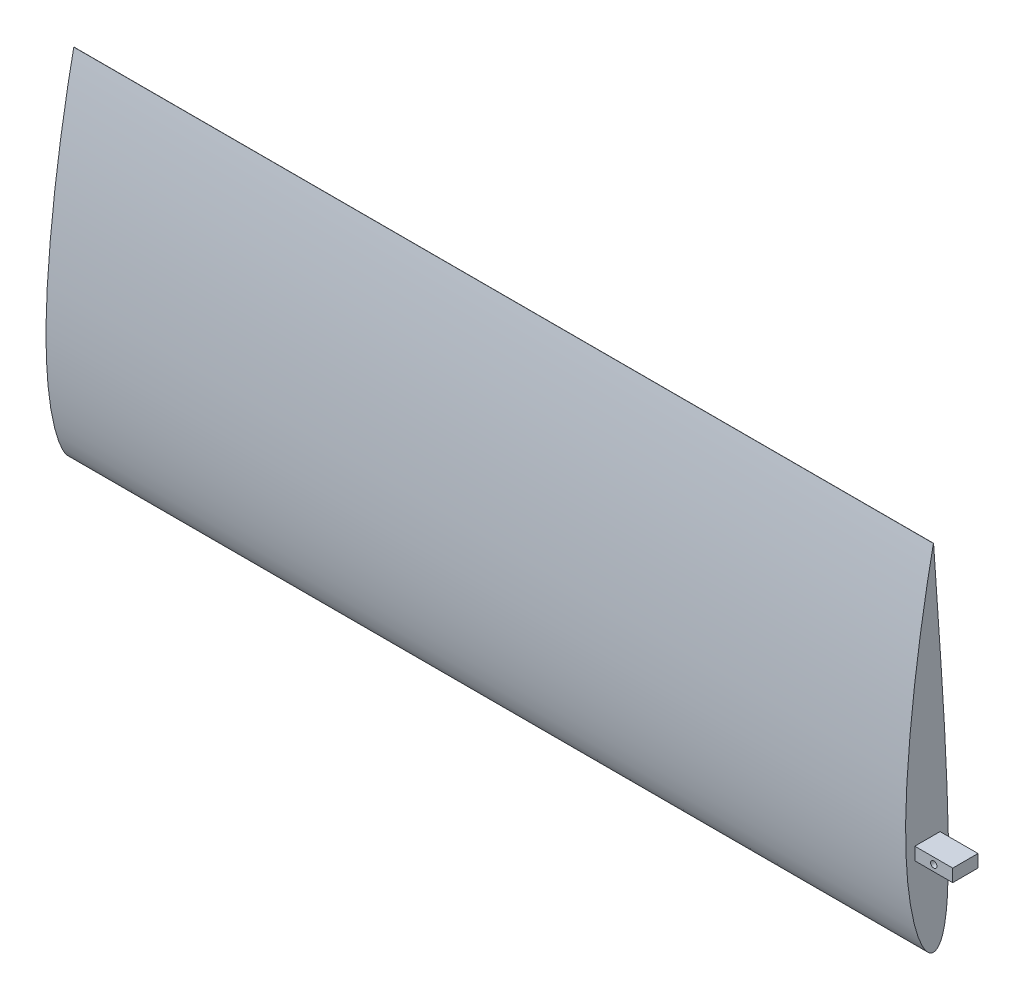
from build123d import *

# Parameters (mm, degrees)
BOSS_EXTRUDE1_DEPTH     = 914.4
CUT_EXTRUDE1_DEPTH      = 982.547981928
CUT_EXTRUDE1_DEPTH_BACK = 982.547981928
SKETCH2_W               = 101.6
SKETCH2_H               = 355.7016
CUT_EXTRUDE3_DEPTH      = 862.965
BOSS_EXTRUDE2_DEPTH     = 862.965
SKETCH7_W               = 25.4
SKETCH7_H               = 12.7
BOSS_EXTRUDE3_DEPTH     = 38.1
SKETCH8_R               = 3.175
CUT_EXTRUDE4_DEPTH      = 982.730874327


with BuildPart() as part:
    # Sketch1 → Boss-Extrude1 (new body)
    with BuildSketch(Plane(origin=(0, 0, 0), x_dir=(0, 0, -1), z_dir=(1, 0, 0))):
        with BuildLine():
            Line((0.107161403, 355.7016), (-0.070689384, 355.7016))
            add(Edge.make_bspline(
                [(-0.070689384, 355.7016), (-0.466477301, 353.821005474), (-1.257390268, 350.062966049), (-2.391261843, 344.419849121), (-3.495815308, 338.780602167), (-4.571931897, 333.145611843), (-5.624146346, 327.516510889), (-6.654132743, 321.894595016), (-7.997398438, 314.419324109), (-9.945522406, 303.25746297), (-12.095688112, 290.277775074), (-14.108266379, 277.369668), (-15.729652448, 266.404083363), (-17.745206313, 251.980108498), (-19.571200264, 237.689627436), (-21.215305741, 223.549431816), (-22.347366905, 213.141900318), (-23.38648148, 202.878012782), (-24.331674295, 192.768060411), (-25.180326784, 182.822187649), (-25.928484577, 173.050367055), (-26.674562593, 161.923020833), (-27.345486328, 149.535714938), (-27.840551721, 135.990974586), (-28.060725611, 122.943312688), (-28.002046095, 110.422427171), (-27.702820577, 99.702001348), (-27.264430386, 90.695171909), (-26.778207129, 83.305058943), (-26.183602895, 76.189184622), (-25.486294476, 69.354718788), (-24.692398131, 62.80853729), (-23.808328586, 56.557201024), (-22.840687769, 50.606973205), (-21.796246166, 44.963830369), (-20.681960011, 39.633415294), (-19.686877519, 35.395642593), (-18.668840846, 31.420703372), (-17.830503911, 28.402995737), (-16.953038009, 25.502253789), (-16.295688834, 23.446152208), (-15.629016033, 21.473655539), (-14.953909817, 19.585256686), (-14.271253624, 17.781420944), (-13.581895135, 16.062595446), (-12.886661884, 14.429199329), (-12.186346807, 12.881628381), (-11.481686051, 11.420261165), (-10.773396292, 10.04543679), (-10.062097884, 8.757490369), (-9.34839284, 7.556709508), (-8.632792002, 6.443369974), (-7.91573903, 5.417716148), (-7.197605959, 4.479967069), (-6.47867767, 3.630320834), (-5.759155979, 2.868957272), (-5.039142048, 2.19605649), (-4.318657554, 1.611798732), (-3.597634906, 1.11641082), (-2.875952573, 0.710164516), (-2.153489626, 0.393485727), (-1.430202503, 0.166619572), (-0.706187065, 0.03077979), (-0.000985808, -0.015114251), (0.684756584, 0.030079625), (1.348697256, 0.166740712), (2.007659563, 0.393317067), (2.659441583, 0.710058446), (3.302103095, 1.116343264), (3.933909812, 1.611857107), (4.553290425, 2.196297771), (5.158827727, 2.869428129), (5.749231153, 3.631048574), (6.323352434, 4.480969847), (6.880184982, 5.418999484), (7.418887755, 6.444929009), (7.938780897, 7.558528262), (8.439333201, 8.759551829), (8.920187899, 10.047719086), (9.38111076, 11.42273555), (9.822040709, 12.884270251), (10.243003979, 14.431978532), (10.644156378, 16.065484925), (11.025729315, 17.78439363), (11.388030769, 19.588284464), (11.731405451, 21.47671562), (12.056228849, 23.449222111), (12.362904642, 25.505314006), (12.65181215, 27.644482252), (12.923317343, 29.866195243), (13.177757541, 32.169900276), (13.499852463, 35.402342989), (13.858312346, 39.644181211), (14.217474108, 44.973851327), (14.512794252, 50.616200438), (14.744290134, 56.565612117), (14.91180091, 62.816123126), (15.015348807, 69.361468336), (15.055556296, 76.19507344), (15.033927365, 83.310049608), (14.95305361, 90.699222818), (14.816566284, 98.355150745), (14.628926379, 106.27014854), (14.395047132, 114.436264929), (14.119797884, 122.845292004), (13.80742065, 131.488784123), (13.461091997, 140.358056449), (13.082513447, 149.444192088), (12.529118258, 161.966906534), (11.914202813, 174.747012914), (11.23057546, 187.771233814), (10.673385511, 197.800288277), (10.076443223, 207.988276057), (9.333666459, 220.087933402), (8.545388829, 232.345213804), (7.727884289, 244.74825108), (7.012410075, 255.522479057), (6.413248687, 264.566087926), (5.812205548, 273.686981089), (5.209897824, 282.876004642), (4.484082626, 293.955761906), (3.867734567, 303.229482659), (3.360161258, 310.676514812), (2.970245095, 316.279904259), (2.570443063, 321.893186998), (2.160539213, 327.514926735), (1.741925541, 333.143678), (1.317712761, 338.777987211), (0.895533142, 344.416460162), (0.48132907, 350.057405862), (0.231880233, 353.820258158), (0.107161403, 355.7016)],
                knots=[0, 0, 0, 0, 0.007940543, 0.015867786, 0.023782336, 0.031683842, 0.039571466, 0.047443805, 0.055299407, 0.070952907, 0.094259966, 0.109659749, 0.124931368, 0.140060475, 0.169836167, 0.184455938, 0.198878988, 0.213091981, 0.227081364, 0.240833733, 0.254335896, 0.267574898, 0.286913018, 0.305591757, 0.323574751, 0.340828862, 0.357323531, 0.367884026, 0.378086462, 0.387923234, 0.397387015, 0.406470797, 0.41516795, 0.423472244, 0.43137777, 0.438879022, 0.445971139, 0.449362331, 0.455832514, 0.458910652, 0.461883669, 0.464751272, 0.467513247, 0.470169459, 0.472719872, 0.475164567, 0.477503762, 0.479737826, 0.481867333, 0.483893084, 0.485816152, 0.487637951, 0.489360303, 0.49098553, 0.492516542, 0.493957004, 0.495311466, 0.496585561, 0.4977862, 0.498921787, 0.500002352, 0.50103964, 0.502046987, 0.503038995, 0.503951731, 0.504878158, 0.505831393, 0.506823576, 0.507865603, 0.508967032, 0.510136107, 0.511379885, 0.512704371, 0.51411466, 0.515615093, 0.517209348, 0.518900571, 0.520691419, 0.522584144, 0.524580638, 0.526682478, 0.528890964, 0.531207133, 0.533631806, 0.536165599, 0.538808937, 0.541562081, 0.544425147, 0.547398108, 0.550480817, 0.553673027, 0.556974385, 0.563902733, 0.571261381, 0.579045037, 0.58724742, 0.595861595, 0.604880098, 0.614294871, 0.624097261, 0.634278056, 0.644827522, 0.655735355, 0.666990799, 0.678582536, 0.690498843, 0.702727789, 0.715257042, 0.728074047, 0.754520377, 0.768123571, 0.781962351, 0.796022904, 0.810291085, 0.832050541, 0.846772874, 0.861649926, 0.876666219, 0.884221743, 0.899417941, 0.914715475, 0.9300999, 0.937820202, 0.945556969, 0.953308312, 0.961072259, 0.968846879, 0.976629764, 0.984418334, 0.992209516, 1, 1, 1, 1], degree=3))
        make_face()
    extrude(amount=-BOSS_EXTRUDE1_DEPTH)

    # Sketch2 → Cut-Extrude1 (cut, two sides: drawn at the far end of the back side and taken through both)
    with BuildSketch(Plane.XY.offset(-CUT_EXTRUDE1_DEPTH_BACK)):
        with Locations((0, 177.8508)):
            Rectangle(SKETCH2_W, SKETCH2_H)
    extrude(amount=CUT_EXTRUDE1_DEPTH + CUT_EXTRUDE1_DEPTH_BACK, mode=Mode.SUBTRACT)

    # Sketch4 → Cut-Extrude3 (cut)
    with BuildSketch(Plane(origin=(-50.8, 0, 0), x_dir=(0, 0, -1), z_dir=(1, 0, 0))):
        with BuildLine():
            add(Edge.make_bspline(
                [(0.001596468, 0.634990121), (0.826967902, 0.634990121), (2.460288034, 1.127474544), (4.471748408, 2.891385333), (6.048409656, 5.115682959), (7.725860803, 8.396685666), (9.248617399, 12.803937935), (10.558588728, 18.266080522), (11.537271469, 23.813406951), (12.540599127, 31.267756807), (13.390897577, 40.646027038), (14.019287877, 51.93516664), (14.364838797, 63.240945561), (14.494341209, 74.553940311), (14.440507649, 89.641826641), (14.046896931, 108.502916127), (13.28515646, 131.132642203), (12.358459727, 153.75815723), (11.295867035, 176.377547342), (10.08079803, 198.988797347), (8.25161926, 229.125707637), (6.215879665, 259.254310072), (4.246071484, 289.388584475), (2.759176481, 311.986719647), (1.243059906, 332.911934061), (0.185033848, 346.644175304), (-0.240044354, 352.854074493), (-0.262610008, 353.185684255)],
                knots=[0.503016093, 0.503016093, 0.503016093, 0.503016093, 0.50689878, 0.510781467, 0.514664154, 0.51854684, 0.526312214, 0.534077587, 0.541842961, 0.549608335, 0.565139082, 0.580669829, 0.596200576, 0.611731323, 0.62726207, 0.658323564, 0.689385058, 0.720446552, 0.751508047, 0.782569541, 0.813631035, 0.875754023, 0.906815517, 0.937877012, 0.968938506, 0.993166121, 0.994532897, 0.994532897, 0.994532897, 0.994532897], degree=3))
            add(Edge.make_bspline(
                [(-0.262610008, 353.185684255), (-0.330089775, 352.861585336), (-1.613269803, 346.682459156), (-4.285724244, 332.991692094), (-9.434644884, 304.554879268), (-15.494971488, 266.846612876), (-20.283754942, 228.954525342), (-23.392595569, 198.561830787), (-25.324232267, 175.73139216), (-26.762300805, 152.867342407), (-27.558019979, 129.975401306), (-27.529610967, 107.073364668), (-26.655615015, 88.010905167), (-25.329926205, 72.809478404), (-23.982889398, 61.446997862), (-22.232135743, 50.142596476), (-20.002416998, 38.927558947), (-17.650066352, 29.698843837), (-15.364424641, 22.442601279), (-13.400772139, 17.092196396), (-11.113363598, 11.885208097), (-8.833207499, 7.747064384), (-6.64177054, 4.711865499), (-4.133557145, 1.997235658), (-1.717329915, 0.635031043), (0.001596468, 0.634990121)],
                knots=[0.00545209, 0.00545209, 0.00545209, 0.00545209, 0.006815112, 0.031438495, 0.06287699, 0.125753979, 0.188630969, 0.220069464, 0.251507959, 0.282946453, 0.314384948, 0.345823443, 0.377261938, 0.392981185, 0.408700433, 0.42441968, 0.440138928, 0.455858175, 0.463717799, 0.471577422, 0.479437046, 0.48729667, 0.491226482, 0.495156294, 0.503015917, 0.503015917, 0.503015917, 0.503015917], degree=3))
        make_face()
    extrude(amount=-CUT_EXTRUDE3_DEPTH, mode=Mode.SUBTRACT)



with BuildPart() as body_2:
    # Sketch6 → Boss-Extrude2 (new body)
    with BuildSketch(Plane(origin=(-50.8, 0, 0), x_dir=(0, 0, -1), z_dir=(1, 0, 0))):
        with BuildLine():
            add(Edge.make_bspline(
                [(-0.262610008, 353.185684255), (-0.330089775, 352.861585336), (-1.613269803, 346.682459156), (-4.285724244, 332.991692094), (-9.434644884, 304.554879268), (-15.494971488, 266.846612876), (-20.283754942, 228.954525342), (-23.392595569, 198.561830787), (-25.324232267, 175.73139216), (-26.762300805, 152.867342407), (-27.558019979, 129.975401306), (-27.529610967, 107.073364668), (-26.655615015, 88.010905167), (-25.329926205, 72.809478404), (-23.982889398, 61.446997862), (-22.232135743, 50.142596476), (-20.002416998, 38.927558947), (-17.650066352, 29.698843837), (-15.364424641, 22.442601279), (-13.400772139, 17.092196396), (-11.113363598, 11.885208097), (-8.833207499, 7.747064384), (-6.64177054, 4.711865499), (-4.133557145, 1.997235658), (-1.717329915, 0.635031043), (0.001596468, 0.634990121)],
                knots=[0.00545209, 0.00545209, 0.00545209, 0.00545209, 0.006815112, 0.031438495, 0.06287699, 0.125753979, 0.188630969, 0.220069464, 0.251507959, 0.282946453, 0.314384948, 0.345823443, 0.377261938, 0.392981185, 0.408700433, 0.42441968, 0.440138928, 0.455858175, 0.463717799, 0.471577422, 0.479437046, 0.48729667, 0.491226482, 0.495156294, 0.503015917, 0.503015917, 0.503015917, 0.503015917], degree=3))
            add(Edge.make_bspline(
                [(0.001596468, 0.634990121), (0.826967902, 0.634990121), (2.460288034, 1.127474544), (4.471748408, 2.891385333), (6.048409656, 5.115682959), (7.725860803, 8.396685666), (9.248617399, 12.803937935), (10.558588728, 18.266080522), (11.537271469, 23.813406951), (12.540599127, 31.267756807), (13.390897577, 40.646027038), (14.019287877, 51.93516664), (14.364838797, 63.240945561), (14.494341209, 74.553940311), (14.440507649, 89.641826641), (14.046896931, 108.502916127), (13.28515646, 131.132642203), (12.358459727, 153.75815723), (11.295867035, 176.377547342), (10.08079803, 198.988797347), (8.25161926, 229.125707637), (6.215879665, 259.254310072), (4.246071484, 289.388584475), (2.759176481, 311.986719647), (1.243059906, 332.911934061), (0.185033848, 346.644175304), (-0.240044354, 352.854074493), (-0.262610008, 353.185684255)],
                knots=[0.503016093, 0.503016093, 0.503016093, 0.503016093, 0.50689878, 0.510781467, 0.514664154, 0.51854684, 0.526312214, 0.534077587, 0.541842961, 0.549608335, 0.565139082, 0.580669829, 0.596200576, 0.611731323, 0.62726207, 0.658323564, 0.689385058, 0.720446552, 0.751508047, 0.782569541, 0.813631035, 0.875754023, 0.906815517, 0.937877012, 0.968938506, 0.993166121, 0.994532897, 0.994532897, 0.994532897, 0.994532897], degree=3))
        make_face()
    extrude(amount=-BOSS_EXTRUDE2_DEPTH)


with BuildPart() as part_1:
    add(part.part)

    add(body_2.part)  # Boss-Extrude3 merges body 2
    # Sketch7 → Boss-Extrude3 (add)
    with BuildSketch(Plane(origin=(-50.8, 0, 0), x_dir=(0, 0, -1), z_dir=(1, 0, 0))):
        with Locations((-6.084827814, 95.2754)):
            Rectangle(SKETCH7_W, SKETCH7_H)
    extrude(amount=BOSS_EXTRUDE3_DEPTH)

    # Sketch8 → Cut-Extrude4 (cut, through all)
    with BuildSketch(Plane.XY.offset(18.784827814)):
        with Locations((-31.75, 95.2754)):
            Circle(SKETCH8_R)
    extrude(amount=-CUT_EXTRUDE4_DEPTH, mode=Mode.SUBTRACT)


solid = part_1.part
